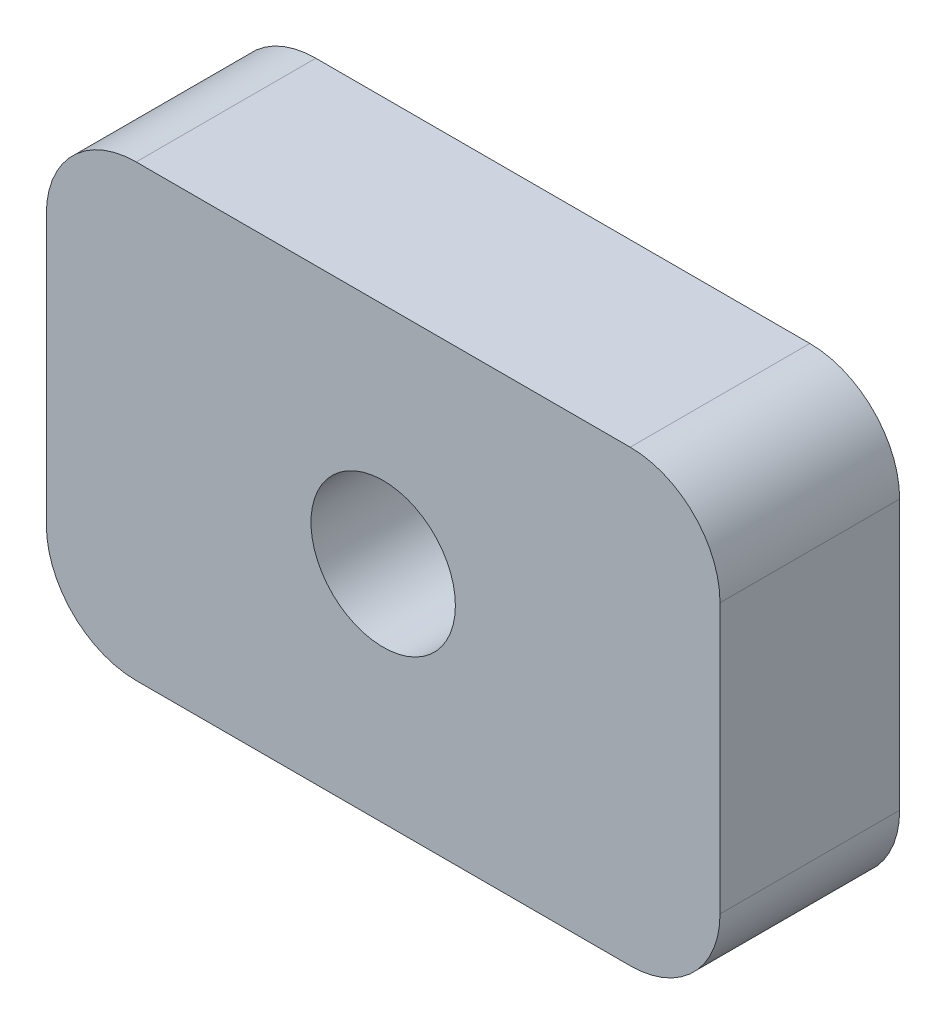
from build123d import *

# Parameters (mm, degrees)
SKETCH1_W               = 23.8125
SKETCH1_H               = 15.875
BASE_FLANGE1_DEPTH      = 6.35
F_1_4_20_TAPPED_HOLE1_D = 5.1054
BREAK_CORNER1_DEPTH     = 6.35


# Read off the part's stored shape, not the designer's step: Break-Corner1
# Sheet-metal steps are written as plain solids
with BuildPart() as part:
    # Sketch1 → Base-Flange1 (new body)
    with BuildSketch(Plane.XY):
        Rectangle(SKETCH1_W, SKETCH1_H)
    extrude(amount=BASE_FLANGE1_DEPTH)

    # 1/4-20 Tapped Hole1 (through all)
    with Locations(Plane.XY.offset(6.35)):
        with Locations((0, 0)):
            Hole(F_1_4_20_TAPPED_HOLE1_D / 2)

    # Break-Corner1 outline → Break-Corner1 (cut)
    with BuildSketch(Plane.XY):
        with BuildLine():
            Line((-11.90625, -7.9375), (-8.73125, -7.9375))
            ThreePointArc((-8.73125, -7.9375), (-10.97631403, -7.00756403), (-11.90625, -4.7625))
            Line((-11.90625, -4.7625), (-11.90625, -7.9375))
        make_face()
        with BuildLine():
            ThreePointArc((11.90625, -4.7625), (10.97631403, -7.00756403), (8.73125, -7.9375))
            Line((8.73125, -7.9375), (11.90625, -7.9375))
            Line((11.90625, -7.9375), (11.90625, -4.7625))
        make_face()
        with BuildLine():
            Line((-11.90625, 7.9375), (-11.90625, 4.7625))
            ThreePointArc((-11.90625, 4.7625), (-10.97631403, 7.00756403), (-8.73125, 7.9375))
            Line((-8.73125, 7.9375), (-11.90625, 7.9375))
        make_face()
        with BuildLine():
            ThreePointArc((8.73125, 7.9375), (10.97631403, 7.00756403), (11.90625, 4.7625))
            Line((11.90625, 4.7625), (11.90625, 7.9375))
            Line((11.90625, 7.9375), (8.73125, 7.9375))
        make_face()
    extrude(amount=BREAK_CORNER1_DEPTH, mode=Mode.SUBTRACT)


solid = part.part
